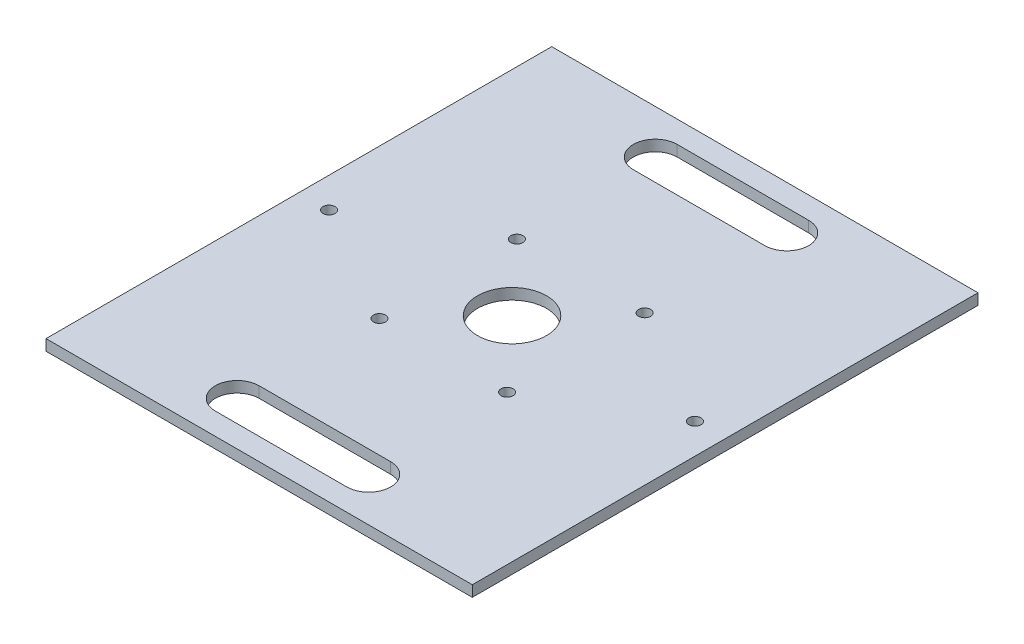
from build123d import *

# Parameters (mm, degrees)
SKETCH1_W         = 247
SKETCH1_H         = 293
MAIN_BASE_DEPTH   = 3.175
HANDLES_DEPTH     = 192.715472772
SKETCH3_R         = 20
CAMERA_HOLE_DEPTH = 192.715472772
ALIGNMENT_HOLES_D = 6.99999997


with BuildPart() as part:
    # Sketch1 → Main Base (new, symmetric)
    with BuildSketch(Plane(origin=(0, 0, 0), x_dir=(1, 0, 0), z_dir=(0, 1, 0))):
        Rectangle(SKETCH1_W, SKETCH1_H)
    extrude(amount=MAIN_BASE_DEPTH, both=True)

    # Sketch2 → Handles (cut, through all)
    with BuildSketch(Plane(origin=(0, 3.175, 0), x_dir=(1, 0, 0), z_dir=(0, 1, 0))):
        with BuildLine():
            Line((-38.1, 133.8), (38.1, 133.8))
            ThreePointArc((38.1, 133.8), (50.8, 121.1), (38.1, 108.4))
            Line((38.1, 108.4), (-38.1, 108.4))
            ThreePointArc((-38.1, 108.4), (-50.8, 121.1), (-38.1, 133.8))
        make_face()
        with BuildLine():
            Line((-38.1, -133.8), (38.1, -133.8))
            ThreePointArc((38.1, -133.8), (50.8, -121.1), (38.1, -108.4))
            Line((38.1, -108.4), (-38.1, -108.4))
            ThreePointArc((-38.1, -108.4), (-50.8, -121.1), (-38.1, -133.8))
        make_face()
    extrude(amount=-HANDLES_DEPTH, mode=Mode.SUBTRACT)

    # Sketch3 → Camera Hole (cut, through all)
    with BuildSketch(Plane(origin=(0, 3.175, 0), x_dir=(1, 0, 0), z_dir=(0, 1, 0))):
        Circle(SKETCH3_R)
    extrude(amount=-CAMERA_HOLE_DEPTH, mode=Mode.SUBTRACT)

    # Alignment Holes (through all)
    with Locations(Plane(origin=(0, 3.175, 0), x_dir=(1, 0, 0), z_dir=(0, 1, 0))):
        with Locations((-106, 0), (-37, -39.837168574), (-37, 39.837168574), (37, 39.837168574), (37, -39.837168574), (106, 0)):
            Hole(ALIGNMENT_HOLES_D / 2)


solid = part.part
